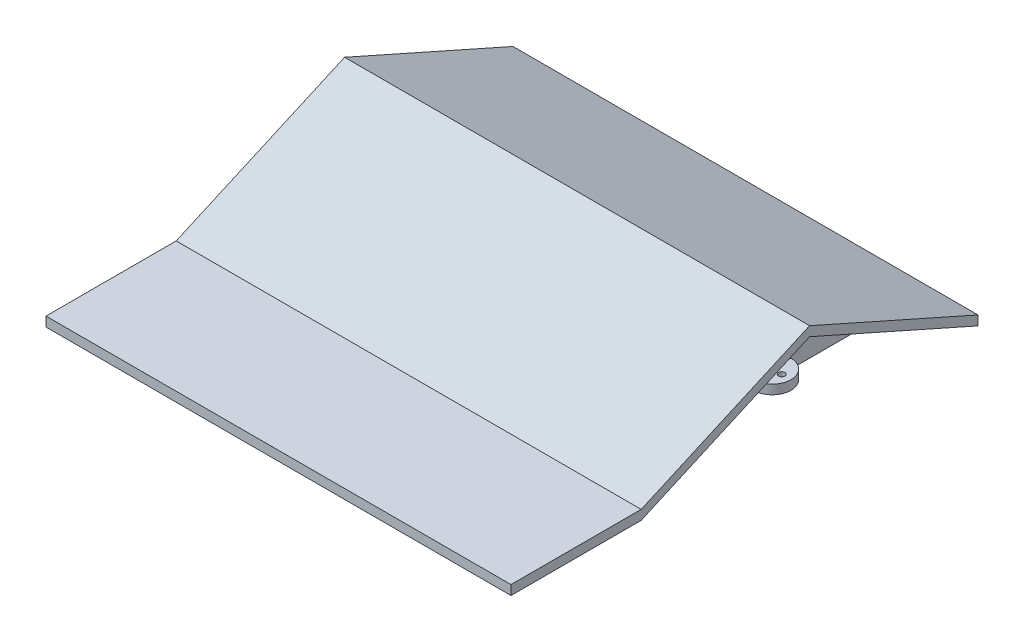
from build123d import *

# Parameters (mm, degrees)
BOSS_EXTRUDE1_DEPTH = 250
BOSS_EXTRUDE2_DEPTH = 25
CUT_EXTRUDE1_DEPTH  = 20
BOSS_EXTRUDE3_DEPTH = 25
CUT_EXTRUDE2_DEPTH  = 20
SKETCH6_R           = 10
SKETCH6_R_2         = 1.7
BOSS_EXTRUDE4_DEPTH = 5
SKETCH7_R           = 10
SKETCH7_R_2         = 1.7
BOSS_EXTRUDE5_DEPTH = 5
CUT_EXTRUDE3_DEPTH  = 10
SKETCH9_W           = 70
SKETCH9_H           = 5.120472302
BOSS_EXTRUDE7_DEPTH = 250


with BuildPart() as part:
    # Sketch1 → Boss-Extrude1 (new body)
    with BuildSketch(Plane(origin=(0, 0, 0), x_dir=(0, 0, -1), z_dir=(1, 0, 0))):
        Polygon((-23.04212536, -10.240944604), (0, 0), (67.5, 30), (135, 0), (158.04212536, -10.240944604), (158.04212536, -5.120472302), (67.5, 35.120472302), (-23.04212536, -5.120472302), align=None)
    extrude(amount=-BOSS_EXTRUDE1_DEPTH)

    # Sketch2 → Boss-Extrude2 (add)
    with BuildSketch(Plane(origin=(0, 0, 0), x_dir=(0, 0, -1), z_dir=(1, 0, 0))):
        Polygon((0, 0), (135, 0), (67.5, 30), align=None)
    extrude(amount=-BOSS_EXTRUDE2_DEPTH)

    # Sketch3 → Cut-Extrude1 (cut)
    with BuildSketch(Plane(origin=(0, 0, 0), x_dir=(0, 0, -1), z_dir=(1, 0, 0))):
        Polygon((0, 0), (135, 0), (67.5, 30), align=None)
    extrude(amount=-CUT_EXTRUDE1_DEPTH, mode=Mode.SUBTRACT)

    # Sketch4 → Boss-Extrude3 (add)
    with BuildSketch(Plane.ZY.offset(250)):
        Polygon((-135, 0), (0, 0), (-67.5, 30), align=None)
    extrude(amount=-BOSS_EXTRUDE3_DEPTH)

    # Sketch5 → Cut-Extrude2 (cut)
    with BuildSketch(Plane.ZY.offset(250)):
        Polygon((-135, 0), (0, 0), (-67.5, 29.582678365), align=None)
    extrude(amount=-CUT_EXTRUDE2_DEPTH, mode=Mode.SUBTRACT)

    # Sketch6 → Boss-Extrude4 (add)
    with BuildSketch(Plane(origin=(0, 0, 0), x_dir=(-1, 0, 0), z_dir=(0, -1, 0))):
        with Locations((230, 67.5)):
            Circle(SKETCH6_R)
        with Locations((235, 67.5)):
            Circle(SKETCH6_R_2, mode=Mode.SUBTRACT)
    extrude(amount=-BOSS_EXTRUDE4_DEPTH)

    # Sketch7 → Boss-Extrude5 (add)
    with BuildSketch(Plane(origin=(0, 0, 0), x_dir=(-1, 0, 0), z_dir=(0, -1, 0))):
        with Locations((20, 67.5)):
            Circle(SKETCH7_R)
        with Locations((15, 67.5)):
            Circle(SKETCH7_R_2, mode=Mode.SUBTRACT)
    extrude(amount=-BOSS_EXTRUDE5_DEPTH)

    # Sketch8 → Cut-Extrude3 (cut)
    with BuildSketch(Plane.ZY.offset(230)):
        with BuildLine():
            ThreePointArc((-67.5, 23.5), (-66.439339828, 23.939339828), (-66, 25))
            ThreePointArc((-66, 25), (-68.560660172, 26.060660172), (-67.5, 23.5))
        make_face()
    extrude(amount=-CUT_EXTRUDE3_DEPTH, mode=Mode.SUBTRACT)

    # Sketch9 → Boss-Extrude7 (add)
    with BuildSketch(Plane.ZY.offset(250)):
        with Locations((58.04212536, -7.680708453)):
            Rectangle(SKETCH9_W, SKETCH9_H)
    extrude(amount=-BOSS_EXTRUDE7_DEPTH)


solid = part.part
